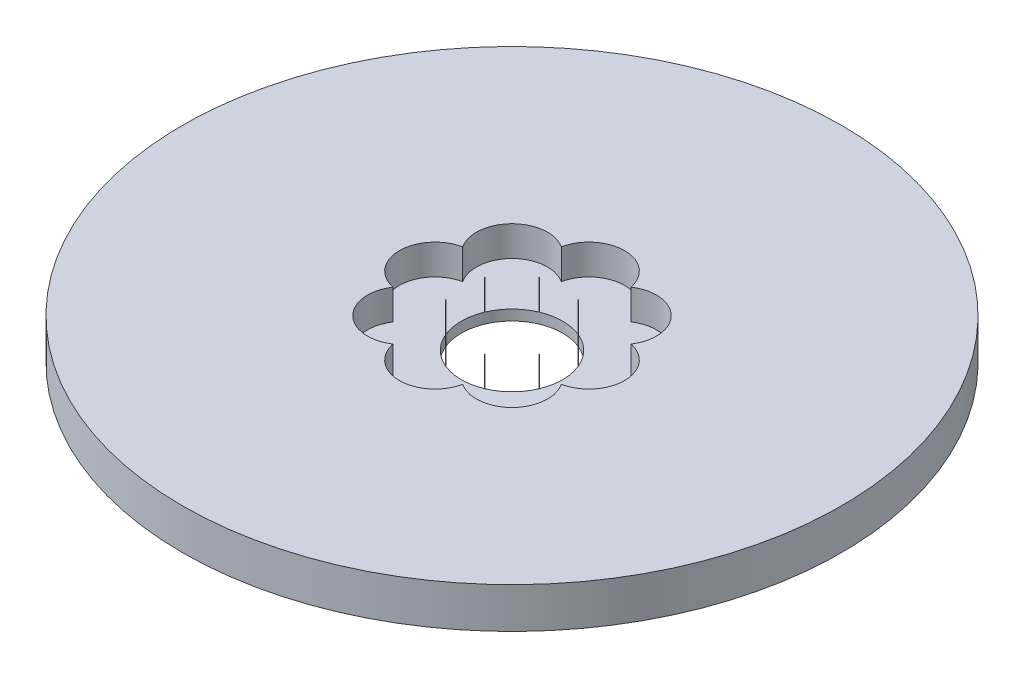
from build123d import *

# Parameters (mm, degrees)
SKETCH1_R           = 65
BOSS_EXTRUDE1_DEPTH = 8
SKETCH2_R           = 10
CUT_EXTRUDE1_DEPTH  = 93.271338995
SKETCH3_R           = 7.026572085
CUT_EXTRUDE2_DEPTH  = 5.949077474
CIRPATTERN1_COUNT   = 8


with BuildPart() as part:
    # Sketch1 → Boss-Extrude1 (new body)
    with BuildSketch(Plane(origin=(0, 0, 0), x_dir=(1, 0, 0), z_dir=(0, 1, 0))):
        Circle(SKETCH1_R)
    extrude(amount=BOSS_EXTRUDE1_DEPTH)

    # Sketch2 → Cut-Extrude1 (cut, through all)
    with BuildSketch(Plane(origin=(0, 0, 0), x_dir=(1, 0, 0), z_dir=(0, 1, 0))):
        Circle(SKETCH2_R)
    extrude(amount=CUT_EXTRUDE1_DEPTH, mode=Mode.SUBTRACT)

    # Sketch3 → Cut-Extrude2 (cut)
    with BuildSketch(Plane(origin=(0, 8, 0), x_dir=(1, 0, 0), z_dir=(0, 1, 0))):
        with Locations((-15.177293881, 0)):
            Circle(SKETCH3_R)
    cut_extrude2 = extrude(amount=-CUT_EXTRUDE2_DEPTH, mode=Mode.SUBTRACT)

    # CirPattern1: Cut-Extrude2 ×8 about axis
    cirpattern1_axis = Axis((0, 0, 0), (0, 1, 0))
    for i in range(1, CIRPATTERN1_COUNT):
        add(cut_extrude2.rotate(cirpattern1_axis, i * 360 / CIRPATTERN1_COUNT), mode=Mode.SUBTRACT)


solid = part.part
